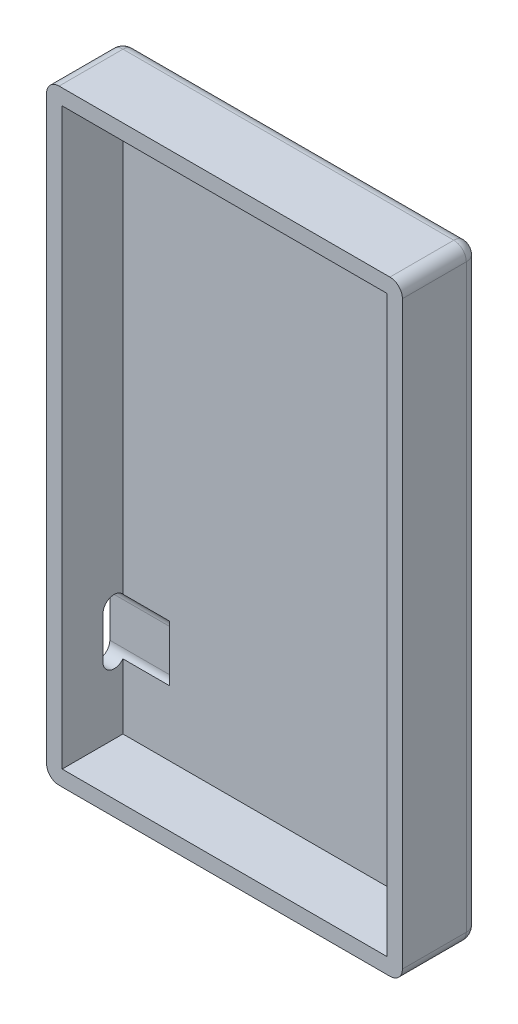
from build123d import *

# Parameters (mm, degrees)
ESQUISSE1_W             = 52
ESQUISSE1_H             = 92
BOSS_EXTRU_1_DEPTH      = 9.73
COQUE1_T                = 2.5
CONG_1_R                = 2
ENL_V_MAT_EXTRU_1_DEPTH = 10
ENL_V_MAT_EXTRU_3_DEPTH = 0.3


with BuildPart() as part:
    # Esquisse1 → Boss.-Extru.1 (new body)
    with BuildSketch(Plane.XY):
        Rectangle(ESQUISSE1_W, ESQUISSE1_H)
    extrude(amount=BOSS_EXTRU_1_DEPTH)

    # Coque1
    coque1_openings = [part.faces().sort_by_distance(p)[0] for p in [
        (0, 0, 9.73),
    ]]
    offset(amount=COQUE1_T, openings=coque1_openings, kind=Kind.INTERSECTION)

    # Congé1
    # the kernel refuses this fillet: 2 mm, written as the material it takes off along each edge
    with BuildSketch(Plane(origin=(-26.5, -46.5, -0.5), x_dir=(0, 0, -1), z_dir=(-1, 0, 0))) as cong_1_piece_1_section:
        Polygon((0, 0), (CONG_1_R, 0), (CONG_1_R, CONG_1_R), (0, CONG_1_R), align=None)
    cong_1_piece_1 = extrude(amount=CONG_1_R, mode=Mode.PRIVATE)
    cong_1_piece_1 = cong_1_piece_1 - Plane(origin=(-26.5, -46.5, -0.5), x_dir=(0, 0.7071067811865475, 0.7071067811865475), z_dir=(-1, 0, 0)) * Sphere(CONG_1_R, mode=Mode.PRIVATE)
    add(cong_1_piece_1, mode=Mode.SUBTRACT)
    with BuildSketch(Plane(origin=(26.5, -46.5, -0.5), x_dir=(0, -1, 0), z_dir=(0, 0, -1))) as cong_1_piece_2_section:
        Polygon((0, 0), (CONG_1_R, 0), (CONG_1_R, -CONG_1_R), (0, -CONG_1_R), align=None)
    cong_1_piece_2 = extrude(amount=CONG_1_R, mode=Mode.PRIVATE)
    cong_1_piece_2 = cong_1_piece_2 - Plane(origin=(26.5, -46.5, -0.5), x_dir=(-0.7071067811865475, 0.7071067811865475, 0), z_dir=(0, 0, -1)) * Sphere(CONG_1_R, mode=Mode.PRIVATE)
    add(cong_1_piece_2, mode=Mode.SUBTRACT)
    with BuildSketch(Plane(origin=(-26.5, 46.5, -0.5), x_dir=(-1, 0, 0), z_dir=(0, 1, 0))) as cong_1_piece_3_section:
        Polygon((0, 0), (CONG_1_R, 0), (CONG_1_R, -CONG_1_R), (0, -CONG_1_R), align=None)
    cong_1_piece_3 = extrude(amount=CONG_1_R, mode=Mode.PRIVATE)
    cong_1_piece_3 = cong_1_piece_3 - Plane(origin=(-26.5, 46.5, -0.5), x_dir=(0.7071067811865475, 0, 0.7071067811865475), z_dir=(0, 1, 0)) * Sphere(CONG_1_R, mode=Mode.PRIVATE)
    add(cong_1_piece_3, mode=Mode.SUBTRACT)
    with BuildSketch(Plane(origin=(26.5, 46.5, -0.5), x_dir=(0, 0, -1), z_dir=(0, 1, 0))) as cong_1_piece_4_section:
        Polygon((0, 0), (CONG_1_R, 0), (CONG_1_R, -CONG_1_R), (0, -CONG_1_R), align=None)
    cong_1_piece_4 = extrude(amount=CONG_1_R, mode=Mode.PRIVATE)
    cong_1_piece_4 = cong_1_piece_4 - Plane(origin=(26.5, 46.5, -0.5), x_dir=(-0.7071067811865475, 0, 0.7071067811865475), z_dir=(0, 1, 0)) * Sphere(CONG_1_R, mode=Mode.PRIVATE)
    add(cong_1_piece_4, mode=Mode.SUBTRACT)
    with BuildSketch(Plane(origin=(-26.5, -48.5, -2.5), x_dir=(0, 0, 1), z_dir=(1, 0, 0)), Plane(origin=(26.5, 48.5, -2.5), x_dir=(0, 0, 1), z_dir=(-1, 0, 0))) as cong_1_piece_5:
        with BuildLine():
            CenterArc((CONG_1_R, -CONG_1_R), CONG_1_R, 90, 90)
            Line((0, -CONG_1_R), (0, 0))
            Line((0, 0), (CONG_1_R, 0))
        make_face()
    extrude(amount=53, mode=Mode.SUBTRACT)
    with BuildSketch(Plane(origin=(-28.5, 46.5, -2.5), x_dir=(0, 0, 1), z_dir=(0, -1, 0)), Plane(origin=(28.5, -46.5, -2.5), x_dir=(0, 0, 1), z_dir=(0, 1, 0))) as cong_1_piece_6:
        with BuildLine():
            CenterArc((CONG_1_R, -CONG_1_R), CONG_1_R, 90, 90)
            Line((0, -CONG_1_R), (0, 0))
            Line((0, 0), (CONG_1_R, 0))
        make_face()
    extrude(amount=93, mode=Mode.SUBTRACT)
    with BuildSketch(Plane(origin=(28.5, -48.5, -0.5), x_dir=(-1, 0, 0), z_dir=(0, 0, 1)), Plane(origin=(-28.5, -48.5, 14.73), x_dir=(1, 0, 0), z_dir=(0, 0, -1)), Plane(origin=(-28.5, 48.5, -0.5), x_dir=(1, 0, 0), z_dir=(0, 0, 1)), Plane(origin=(28.5, 48.5, -0.5), x_dir=(0, -1, 0), z_dir=(0, 0, 1))) as cong_1_piece_7:
        with BuildLine():
            CenterArc((CONG_1_R, -CONG_1_R), CONG_1_R, 90, 90)
            Line((0, -CONG_1_R), (0, 0))
            Line((0, 0), (CONG_1_R, 0))
        make_face()
    extrude(amount=15.23, mode=Mode.SUBTRACT)

    # Esquisse2 → Enlèv. mat.-Extru.1 (cut)
    with BuildSketch(Plane.ZY.offset(28.5)):
        with BuildLine():
            Line((3.2008816, -27.740794349), (3.2008816, -34.440794349))
            ThreePointArc((3.2008816, -34.440794349), (1.4, -36.241675948), (-0.4008816, -34.440794349))
            Line((-0.4008816, -34.440794349), (-0.4008816, -27.740794349))
            ThreePointArc((-0.4008816, -27.740794349), (1.4, -25.939912749), (3.2008816, -27.740794349))
        make_face()
    extrude(amount=-ENL_V_MAT_EXTRU_1_DEPTH, mode=Mode.SUBTRACT)

    # Esquisse3 → Enlèv. mat.-Extru.3 (cut)
    with BuildSketch(Plane(origin=(2.40458604, 5.05579629, -2.5), x_dir=(-1, 0, 0), z_dir=(0, 0, -1))):
        with BuildLine():
            ThreePointArc((4.432568846, -13.261288916), (4.216995781, -13.347231146), (4.12723276, -13.561241456))
            Line((4.12723276, -13.561241456), (4.12723276, -17.926139223))
            Line((4.12723276, -17.926139223), (1.770623661, -17.926139223))
            Line((1.770623661, -17.926139223), (1.770623661, -13.395686185))
            Line((1.770623661, -13.395686185), (-0.5550959, -13.395686185))
            Line((-0.5550959, -13.395686185), (-0.5550959, -17.926139223))
            Line((-0.5550959, -17.926139223), (-2.840872053, -17.926139223))
            Line((-2.840872053, -17.926139223), (-2.840872053, -13.395686185))
            Line((-2.840872053, -13.395686185), (-8.285917815, -13.395686185))
            Line((-8.285917815, -13.395686185), (-7.384139614, -10.715400976))
            Line((-7.384139614, -10.715400976), (-4.73260744, -10.715400976))
            Line((-4.73260744, -10.715400976), (-4.73260744, 3.629932304))
            Line((-4.73260744, 3.629932304), (-8.481683027, 3.629932304))
            Line((-8.481683027, 3.629932304), (-8.481683027, 6.035056002))
            Line((-8.481683027, 6.035056002), (-2.840872053, 6.035056002))
            Line((-2.840872053, 6.035056002), (-2.840872053, 10.899070066))
            Line((-2.840872053, 10.899070066), (-0.5550959, 10.899070066))
            Line((-0.5550959, 10.899070066), (-0.5550959, 6.035056002))
            Line((-0.5550959, 6.035056002), (1.770623661, 6.035056002))
            Line((1.770623661, 6.035056002), (1.770623661, 10.899070066))
            Line((1.770623661, 10.899070066), (4.12723276, 10.899070066))
            Line((4.12723276, 10.899070066), (4.12723276, 6.246143352))
            ThreePointArc((4.12723276, 6.246143352), (4.227791491, 6.022038064), (4.46205396, 5.948171065))
            add(Edge.make_bspline(
                [(4.432568846, -13.261288916), (4.849636806, -13.268708458), (5.98048136, -13.271449308), (7.794832478, -13.090271032), (9.783873696, -12.344515621), (11.540556036, -11.052358459), (12.564181649, -9.179795832), (12.955550354, -7.143685881), (12.593966957, -5.21310593), (11.646751192, -3.465266484), (10.232722145, -2.740195794), (9.250057043, -2.561034839), (8.750477475, -2.542580923), (8.50068383, -2.219648818), (8.784009377, -1.934125986), (9.226109387, -1.668162515), (9.919121901, -1.102236302), (10.570682868, -0.118824042), (11.103114061, 1.16921053), (11.036403439, 2.73148482), (10.346932114, 4.232154462), (9.027316851, 5.196599259), (7.619143878, 5.628972396), (6.275382284, 5.94833303), (5.214289363, 6.012654431), (4.618172733, 5.966415188), (4.46205396, 5.948171065)],
                knots=[0.009261903, 0.009261903, 0.009261903, 0.009261903, 0.047134138, 0.111411615, 0.173043756, 0.237437897, 0.304153642, 0.361015466, 0.421832084, 0.478884562, 0.534307736, 0.557824401, 0.569788977, 0.5785267, 0.586794862, 0.600583119, 0.627786372, 0.665364189, 0.706885293, 0.751518655, 0.802969516, 0.850764387, 0.894339537, 0.935725195, 0.97558798, 0.989801524, 0.989801524, 0.989801524, 0.989801524], degree=3))
        make_face()
        with BuildLine():
            Line((-0.5550959, 3.686744271), (3.348191015, 3.686744271))
            add(Edge.make_bspline(
                [(3.348191015, 3.686744271), (4.141267216, 3.56069148), (5.366493628, 3.347369666), (6.283213897, 2.246261692), (6.444658055, 1.326625386), (6.441596122, 0.427967574), (6.110231896, -0.541286606), (5.40923725, -1.183233231), (4.474914869, -1.684808073), (3.757208507, -1.861144467), (3.348191015, -1.921662594)],
                knots=[0, 0, 0, 0, 0.269919589, 0.369123458, 0.441025413, 0.567546851, 0.657930272, 0.763523098, 0.865803246, 1, 1, 1, 1], degree=3))
            Line((3.348191015, -1.921662594), (-0.5550959, -1.921662594))
            Line((-0.5550959, -1.921662594), (-0.5550959, 3.686744271))
        make_face(mode=Mode.SUBTRACT)
        with BuildLine():
            Line((-0.42913087, -4.167643381), (3.992403585, -4.167643381))
            add(Edge.make_bspline(
                [(3.992403585, -4.167643381), (4.587512864, -4.272183954), (5.572497818, -4.32153134), (6.639994555, -5.013685273), (7.566714866, -5.647143489), (8.000595426, -6.907925525), (7.999345796, -8.175630682), (7.65286389, -9.305868029), (6.888383055, -10.137129269), (5.696203316, -10.591976345), (4.820749189, -10.938794377), (4.302446939, -10.89171276)],
                knots=[0, 0, 0, 0, 0.161654957, 0.24756242, 0.333429326, 0.451191423, 0.578889109, 0.665800718, 0.756992871, 0.864854658, 1, 1, 1, 1], degree=3))
            Line((4.302446939, -10.89171276), (-0.42913087, -10.89171276))
            Line((-0.42913087, -10.89171276), (-0.42913087, -4.167643381))
        make_face(mode=Mode.SUBTRACT)
    extrude(amount=-ENL_V_MAT_EXTRU_3_DEPTH, mode=Mode.SUBTRACT)


solid = part.part
